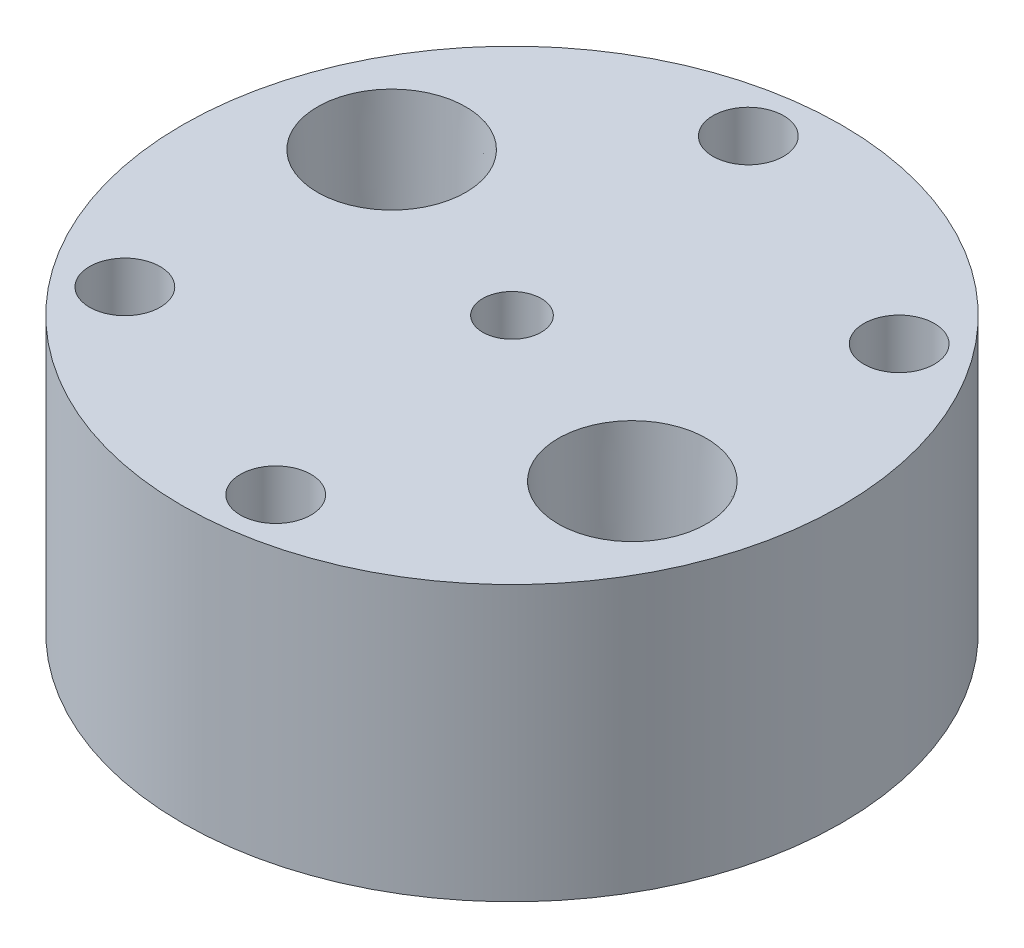
from build123d import *

# Parameters (mm, degrees)
SKETCH1_R                         = 30.48
BOSS_EXTRUDE1_DEPTH               = 25.4
F_1_4_28_TAPPED_HOLE1_D           = 5.4102
SKETCH7_R                         = 11.43
CUT_EXTRUDE2_DEPTH                = 12.7
F_1_4_CLEARANCE_HOLE1_D           = 6.5278
F_1_4_NPT_TAPPED_HOLE1_AT_2_COUNT = 2
F_1_4_NPT_TAPPED_HOLE1_AT_2_PITCH = 40.7035
CUT_EXTRUDE3_DEPTH                = 12.7
GASKET_SLOT_DEPTH                 = 1.27


with BuildPart() as part:
    # Sketch1 → Boss-Extrude1 (new body)
    with BuildSketch(Plane(origin=(0, 0, 0), x_dir=(1, 0, 0), z_dir=(0, 1, 0))):
        Circle(SKETCH1_R)
    extrude(amount=BOSS_EXTRUDE1_DEPTH)

    # 1/4-28 Tapped Hole1 (through all)
    with Locations(Plane(origin=(0, 25.4, 0), x_dir=(1, 0, 0), z_dir=(0, 1, 0))):
        with Locations((0, 0)):
            Hole(F_1_4_28_TAPPED_HOLE1_D / 2)

    # Sketch7 → Cut-Extrude2 (cut)
    with BuildSketch(Plane.XZ):
        Circle(SKETCH7_R)
    extrude(amount=-CUT_EXTRUDE2_DEPTH, mode=Mode.SUBTRACT)

    # 1/4 Clearance Hole1 (through all)
    with Locations(Plane(origin=(0, 25.4, 0), x_dir=(1, 0, 0), z_dir=(0, 1, 0))):
        with Locations((20.175514493, 15.615257641), (3.435452557, -25.280136906), (-3.435452557, 25.280136906), (-20.175514493, -15.615257641)):
            Hole(F_1_4_CLEARANCE_HOLE1_D / 2)

    # Sketch12 → 1/4 NPT Tapped Hole1 (revolve, cut)
    with BuildSketch(Plane(origin=(-18.83486521, 25.4, -7.709836613), x_dir=(0, 0, 1), z_dir=(1, 0, 0))):
        Polygon((0, 0), (0, 25.4), (5.5626, 25.4), (5.5626, 9.906), (6.557984794, 9.906), (6.8545837, 0), align=None)
    f_1_4_npt_tapped_hole1 = revolve(axis=Axis((-18.83486521, 31.75, -7.709836613), (0, -1, 0)), mode=Mode.SUBTRACT)

    # 1/4 NPT Tapped Hole1 at 2: 1/4 NPT Tapped Hole1 ×2
    with Locations(*[Vector(0.9254666163685309, 0, 0.37882917256645177) * (i * F_1_4_NPT_TAPPED_HOLE1_AT_2_PITCH) for i in range(1, F_1_4_NPT_TAPPED_HOLE1_AT_2_COUNT)]):
        add(f_1_4_npt_tapped_hole1, mode=Mode.SUBTRACT)

    # Sketch13 → Cut-Extrude3 (cut)
    with BuildSketch(Plane.XZ):
        with BuildLine():
            Line((-7.195822597, 8.880598919), (-22.336832207, -3.387945139))
            ThreePointArc((-22.336832207, -3.387945139), (-23.98286581, -9.817111768), (-18.30123054, -13.246780969))
            Line((-18.30123054, -13.246780969), (1.096509596, -11.377282923))
            ThreePointArc((1.096509596, -11.377282923), (4.330017442, -10.578083425), (7.195822597, -8.880598919))
            Line((7.195822597, -8.880598919), (22.336832207, 3.387945139))
            ThreePointArc((22.336832207, 3.387945139), (23.98286581, 9.817111768), (18.30123054, 13.246780969))
            Line((18.30123054, 13.246780969), (-1.096509596, 11.377282923))
            ThreePointArc((-1.096509596, 11.377282923), (-4.330017442, 10.578083425), (-7.195822597, 8.880598919))
        make_face()
    extrude(amount=-CUT_EXTRUDE3_DEPTH, mode=Mode.SUBTRACT)

    # Sketch16 → gasket slot (cut)
    with BuildSketch(Plane.XZ):
        with BuildLine():
            Line((17.960094221, 16.7863801), (-1.437645914, 14.916882054))
            ThreePointArc((-1.437645914, 14.916882054), (-5.67713398, 13.869042713), (-9.43452296, 11.643451916))
            Line((-9.43452296, 11.643451916), (-24.57553257, -0.625092142))
            ThreePointArc((-24.57553257, -0.625092142), (-27.273825098, -11.164228306), (-17.960094221, -16.7863801))
            Line((-17.960094221, -16.7863801), (1.437645914, -14.916882054))
            ThreePointArc((1.437645914, -14.916882054), (5.67713398, -13.869042713), (9.43452296, -11.643451916))
            Line((9.43452296, -11.643451916), (24.57553257, 0.625092142))
            ThreePointArc((24.57553257, 0.625092142), (27.273825098, 11.164228306), (17.960094221, 16.7863801))
        make_face()
        with BuildLine():
            Line((18.15502926, 14.763752025), (-1.242710875, 12.894253979))
            ThreePointArc((-1.242710875, 12.894253979), (-4.907353101, 11.988494548), (-8.15526561, 10.064678774))
            Line((-8.15526561, 10.064678774), (-23.29627522, -2.203865283))
            ThreePointArc((-23.29627522, -2.203865283), (-25.393276933, -10.394447427), (-18.15502926, -14.763752025))
            Line((-18.15502926, -14.763752025), (1.242710875, -12.894253979))
            ThreePointArc((1.242710875, -12.894253979), (4.907353101, -11.988494548), (8.15526561, -10.064678774))
            Line((8.15526561, -10.064678774), (23.29627522, 2.203865283))
            ThreePointArc((23.29627522, 2.203865283), (25.393276933, 10.394447427), (18.15502926, 14.763752025))
        make_face(mode=Mode.SUBTRACT)
    extrude(amount=-GASKET_SLOT_DEPTH, mode=Mode.SUBTRACT)


solid = part.part
